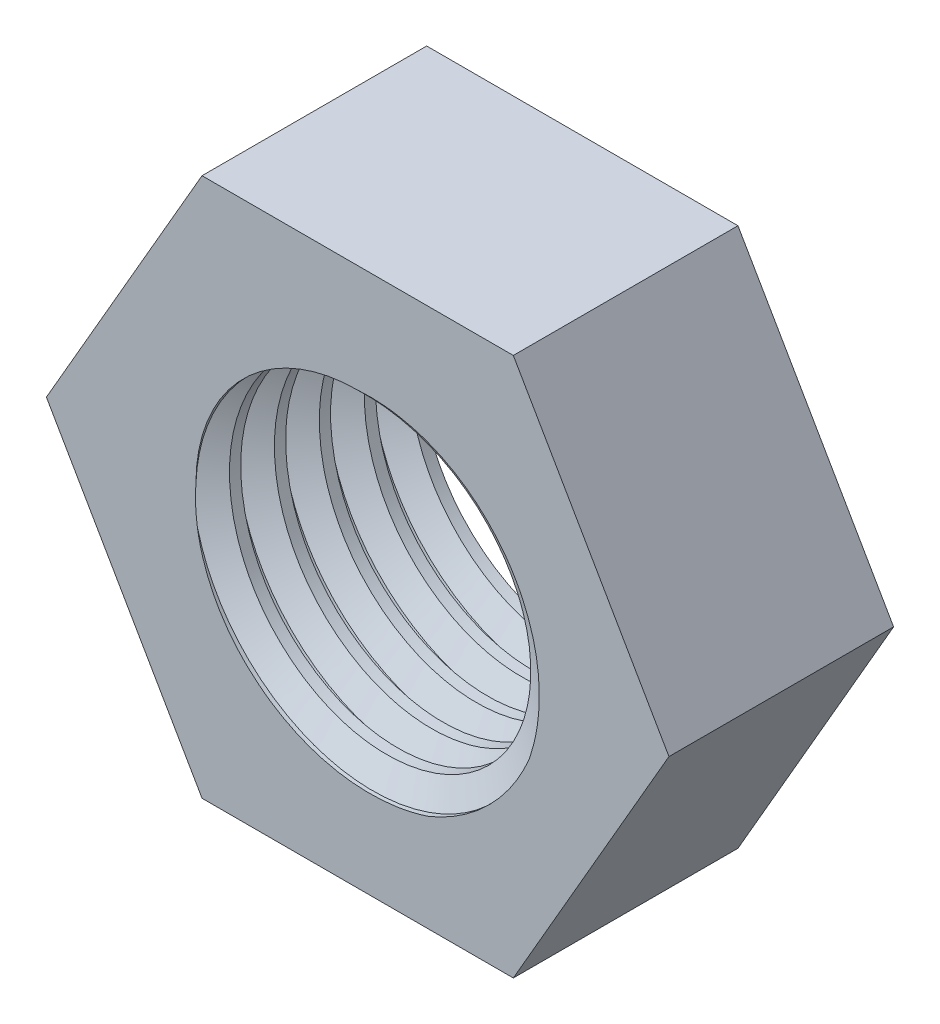
from build123d import *

# Parameters (mm, degrees)
BOSS_EXTRUDE1_DEPTH = 5
SKETCH2_R           = 3.6
CUT_EXTRUDE1_DEPTH  = 11.440306509
THREAD1_PITCH       = 1


with BuildPart() as part:
    # Sketch1 → Boss-Extrude1 (new body)
    with BuildSketch(Plane.XY):
        Polygon((-3.464101615, 6), (-6.92820323, 0), (-3.464101615, -6), (3.464101615, -6), (6.92820323, 0), (3.464101615, 6), align=None)
    extrude(amount=BOSS_EXTRUDE1_DEPTH)

    # Sketch2 → Cut-Extrude1 (cut, through all)
    with BuildSketch(Plane.XY.offset(5)):
        Circle(SKETCH2_R)
    extrude(amount=-CUT_EXTRUDE1_DEPTH, mode=Mode.SUBTRACT)

    # Thread1: the profile of Thread Profile1 profile screwed along a right-hand helix of 6 turns, 8 arcs to a turn; built about Z, then put on its axis
    thread1_z = Axis((0, 0, 0), (0, 0, 1))
    thread1_corners = [(3.5997, 0, -0.000173205), (4.141265875, 0, 0.312499999), (4.141265875, 0, 0.437499999), (3.5997, 0, 0.750173202)]
    with BuildLine(mode=Mode.PRIVATE) as thread1_profile:
        Line(thread1_corners[0], thread1_corners[1])
        Line(thread1_corners[1], thread1_corners[2])
        Line(thread1_corners[2], thread1_corners[3])
        Line(thread1_corners[3], thread1_corners[0])
    thread1_cap = Face(thread1_profile.wire())
    thread1_turn_angles = [0, 22.5, 45, 67.5, 90, 112.5, 135, 157.5, 180, 202.5, 225, 247.5, 270, 292.5, 315, 337.5, 360]
    thread1_turn_weights = [1, 0.9238795325112867, 1, 0.9238795325112867, 1, 0.9238795325112867, 1, 0.9238795325112867, 1, 0.9238795325112867, 1, 0.9238795325112867, 1, 0.9238795325112867, 1, 0.9238795325112867, 1]
    thread1_turn_rails = [Edge.make_bspline([Vector(p[0], p[1], 0).rotate(thread1_z, thread1_turn_angles[k]) / thread1_turn_weights[k] + Vector(0, 0, p[2] + THREAD1_PITCH * thread1_turn_angles[k] / 360) for k in range(17)], [0, 0, 0, 1, 1, 2, 2, 3, 3, 4, 4, 5, 5, 6, 6, 7, 7, 8, 8, 8], 2, thread1_turn_weights) for p in thread1_corners]
    thread1_turn_sides = [Face.make_surface_from_curves(thread1_turn_rails[p[0]], thread1_turn_rails[p[1]]) for p in [(0, 1), (1, 2), (2, 3), (3, 0)]]
    thread1 = Plane(origin=(0, 0, 6), x_dir=(-1, 0, 0), z_dir=(0, 0, -1)) * Solid(Shell([*[p.moved(Location((0, 0, THREAD1_PITCH * i))) for i in range(6) for p in thread1_turn_sides], thread1_cap, thread1_cap.rotate(thread1_z, 2160).moved(Location((0, 0, THREAD1_PITCH * 2160 / 360)))]))
    add(thread1, mode=Mode.SUBTRACT)


solid = part.part
